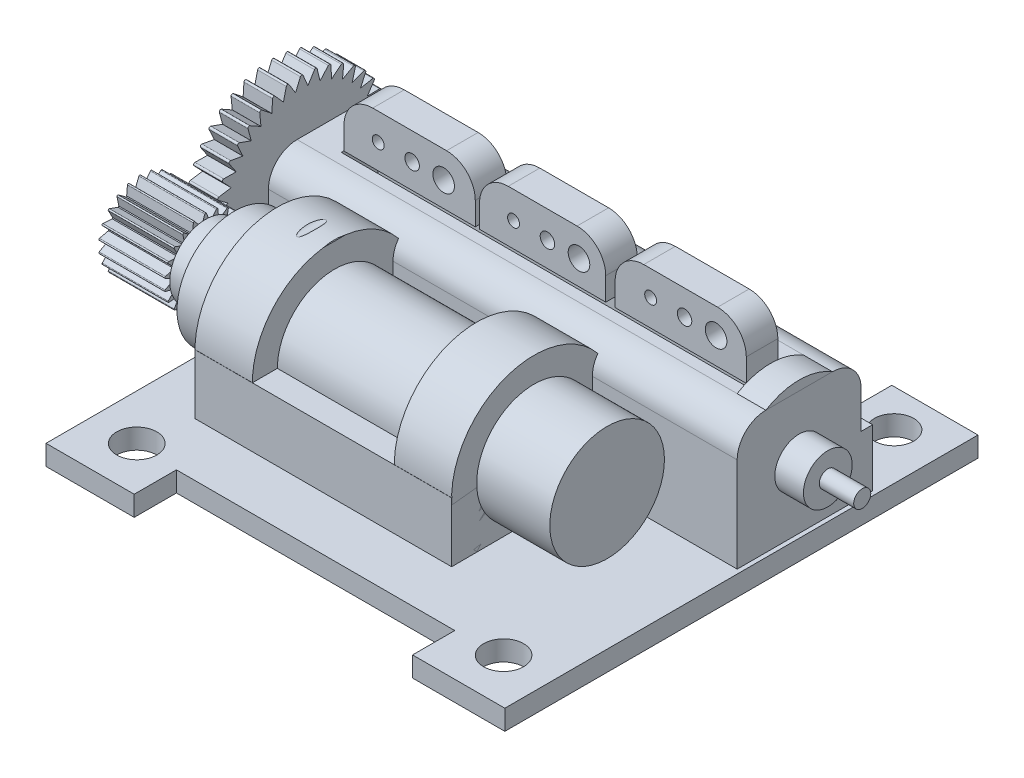
from build123d import *

# Parameters (mm, degrees)
SKETCH1_R            = 0.7
SKETCH1_R_2          = 0.698053641
SKETCH1_R_3          = 0.70259798
SKETCH1_R_4          = 0.686303637
BOSS_EXTRUDE1_DEPTH  = 0.7
SKETCH2_W            = 16.3459471
SKETCH2_H            = 4.323117534
BOSS_EXTRUDE2_DEPTH  = 4.3
SKETCH3_R            = 1.999180089
BOSS_EXTRUDE3_DEPTH  = 13
SKETCH5_R            = 1.25
BOSS_EXTRUDE4_DEPTH  = 1
BOSS_EXTRUDE5_DEPTH  = 2.3
SKETCH7_R            = 1.001282639
BOSS_EXTRUDE6_DEPTH  = 1
BOSS_EXTRUDE7_DEPTH  = 1
SKETCH9_W            = 14.057541038
SKETCH9_H            = 1.275060412
CUT_EXTRUDE1_DEPTH   = 3
SKETCH10_W           = 4.574870121
SKETCH10_H           = 1.1
BOSS_EXTRUDE8_DEPTH  = 1.8
SKETCH11_W           = 1.783665416
SKETCH11_H           = 3.090011918
BOSS_EXTRUDE9_DEPTH  = 1.7
SKETCH12_W           = 4.198120069
SKETCH12_H           = 4.229924008
SKETCH12_W_2         = 2.890350011
SKETCH12_H_2         = 3.141275145
SKETCH12_W_3         = 2.798110633
SKETCH12_H_3         = 1.557438937
SKETCH12_W_4         = 3.160997563
SKETCH12_H_4         = 1.003096265
BOSS_EXTRUDE10_DEPTH = 1
SKETCH13_R           = 0.85
BOSS_EXTRUDE11_DEPTH = 1
SKETCH14_R           = 0.297718491
BOSS_EXTRUDE12_DEPTH = 1.2
SKETCH16_R           = 1.999180089
BOSS_EXTRUDE13_DEPTH = 2
SKETCH17_R           = 1.999180089
BOSS_EXTRUDE17_DEPTH = 2
FILLET1_R            = 1
SKETCH20_R           = 0.20760026
SKETCH20_R_2         = 0.252645321
SKETCH20_R_3         = 0.376796042
CUT_EXTRUDE2_DEPTH   = 2
SKETCH23_W           = 4.574870122
SKETCH23_H           = 1.1
BOSS_EXTRUDE18_DEPTH = 1.8
FILLET2_R            = 1
FILLET3_R            = 1
SKETCH26_W           = 16.3459471
SKETCH26_H           = 2
BOSS_EXTRUDE19_DEPTH = 0.4
BOSS_EXTRUDE20_DEPTH = 1
BOSS_EXTRUDE22_DEPTH = 8.95
SKETCH29_R           = 0.402348732
BOSS_EXTRUDE23_DEPTH = 0.1
SKETCH30_R           = 0.399250569
BOSS_EXTRUDE24_DEPTH = 0.1
SKETCH31_W           = 4.4
SKETCH31_H           = 1.1
BOSS_EXTRUDE26_DEPTH = 1.8
FILLET4_R            = 1
SKETCH32_R           = 0.20760026
SKETCH32_R_2         = 0.252645321
SKETCH32_R_3         = 0.376796042
CUT_EXTRUDE4_DEPTH   = 1.1
SKETCH24_R           = 0.20760026
SKETCH24_R_2         = 0.252645321
SKETCH24_R_3         = 0.376796042
CUT_EXTRUDE5_DEPTH   = 10


with BuildPart() as part:
    # Sketch1 → Boss-Extrude1 (new body)
    with BuildSketch(Plane(origin=(0, 0, 0), x_dir=(1, 0, 0), z_dir=(0, 1, 0))):
        Polygon((-145.69654156, -70.199327588), (-145.69654156, -68.726571204), (-135.989831662, -68.726571204), (-135.989831662, -70.199327588), (-132.772327238, -70.199327588), (-132.772327238, -53.699327588), (-135.777081856, -53.699327588), (-135.777081856, -55.004208719), (-145.69654156, -55.004208719), (-145.69654156, -53.699327588), (-148.772327238, -53.699327588), (-148.772327238, -70.199327588), align=None)
        with Locations(Location((-147.185790201, -68.620196301, 0), (0, 0, 270))):
            Circle(SKETCH1_R, mode=Mode.SUBTRACT)
        with Locations(Location((-134.394208117, -68.620196301, 0), (0, 0, 270))):
            Circle(SKETCH1_R_2, mode=Mode.SUBTRACT)
        with Locations(Location((-147.185790201, -55.004208719, 0), (0, 0, 270))):
            Circle(SKETCH1_R_3, mode=Mode.SUBTRACT)
        with Locations(Location((-134.394208117, -55.004208719, 0), (0, 0, 270))):
            Circle(SKETCH1_R_4, mode=Mode.SUBTRACT)
    extrude(amount=BOSS_EXTRUDE1_DEPTH)



with BuildPart() as body_2:
    # Sketch2 → Boss-Extrude2 (new body)
    with BuildSketch(Plane(origin=(0, 0.7, 0), x_dir=(1, 0, 0), z_dir=(0, 1, 0))):
        with Locations((-141.093486541, -59.787768821)):
            Rectangle(SKETCH2_W, SKETCH2_H)
    extrude(amount=BOSS_EXTRUDE2_DEPTH)

    # Sketch7 → Boss-Extrude6 (add)
    with BuildSketch(Plane.ZY.offset(149.266460091)):
        with Locations(Location((59.787768821, 2.85, 0), (0, 0, 180))):
            Circle(SKETCH7_R)
    extrude(amount=BOSS_EXTRUDE6_DEPTH)



with BuildPart() as body_3:
    # Sketch3 → Boss-Extrude3 (new body)
    with BuildSketch(Plane(origin=(-135.420512991, 0, 0), x_dir=(0, 0, -1), z_dir=(1, 0, 0))):
        with Locations((-63.984477725, 2.780242766)):
            Circle(SKETCH3_R)
    extrude(amount=-BOSS_EXTRUDE3_DEPTH)

    # Sketch5 → Boss-Extrude4 (add)
    with BuildSketch(Plane.ZY.offset(148.420512991)):
        with Locations(Location((63.984477725, 2.780242766, 0), (0, 0, 180))):
            Circle(SKETCH5_R)
    extrude(amount=BOSS_EXTRUDE4_DEPTH)

    # Sketch6 → Boss-Extrude5 (add)
    with BuildSketch(Plane.ZY.offset(149.420512991)):
        with BuildLine():
            Line((63.956467471, 4.202668462), (63.840425796, 3.900130487))
            Line((63.840425796, 3.900130487), (63.807185708, 3.895351284))
            Line((63.807185708, 3.895351284), (63.610609739, 4.152941627))
            ThreePointArc((63.610609739, 4.152941627), (63.578308951, 4.163526576), (63.556858455, 4.137158826))
            Line((63.556858455, 4.137158826), (63.53075208, 3.814183047))
            Line((63.53075208, 3.814183047), (63.500204907, 3.80023262))
            Line((63.500204907, 3.80023262), (63.23902006, 3.992006895))
            ThreePointArc((63.23902006, 3.992006895), (63.205045556, 3.993062895), (63.191892609, 3.961719921))
            Line((63.191892609, 3.961719921), (63.257836518, 3.644471915))
            Line((63.257836518, 3.644471915), (63.232457009, 3.622480445))
            Line((63.232457009, 3.622480445), (62.927822927, 3.732902239))
            ThreePointArc((62.927822927, 3.732902239), (62.89492712, 3.72434374), (62.891137295, 3.690564763))
            Line((62.891137295, 3.690564763), (63.043789105, 3.404746077))
            Line((63.043789105, 3.404746077), (63.025633357, 3.376495182))
            Line((63.025633357, 3.376495182), (62.702229682, 3.396618779))
            ThreePointArc((62.702229682, 3.396618779), (62.673077594, 3.379139139), (62.678957921, 3.345660731))
            Line((62.678957921, 3.345660731), (62.905950689, 3.114426695))
            Line((62.905950689, 3.114426695), (62.896489573, 3.082205094))
            Line((62.896489573, 3.082205094), (62.580516547, 3.010400199))
            ThreePointArc((62.580516547, 3.010400199), (62.557469907, 2.985415516), (62.572543997, 2.954949898))
            Line((62.572543997, 2.954949898), (62.855488119, 2.797033718))
            Line((62.855488119, 2.797033718), (62.855488119, 2.763451814))
            Line((62.855488119, 2.763451814), (62.572543997, 2.605535634))
            ThreePointArc((62.572543997, 2.605535634), (62.557469907, 2.575070016), (62.580516547, 2.550085333))
            Line((62.580516547, 2.550085333), (62.896489573, 2.478280438))
            Line((62.896489573, 2.478280438), (62.905950689, 2.446058838))
            Line((62.905950689, 2.446058838), (62.678957921, 2.214824801))
            ThreePointArc((62.678957921, 2.214824801), (62.673077594, 2.181346393), (62.702229682, 2.163866754))
            Line((62.702229682, 2.163866754), (63.025633357, 2.18399035))
            Line((63.025633357, 2.18399035), (63.043789105, 2.155739455))
            Line((63.043789105, 2.155739455), (62.891137295, 1.869920769))
            ThreePointArc((62.891137295, 1.869920769), (62.89492712, 1.836141792), (62.927822927, 1.827583293))
            Line((62.927822927, 1.827583293), (63.232457009, 1.938005087))
            Line((63.232457009, 1.938005087), (63.257836518, 1.916013617))
            Line((63.257836518, 1.916013617), (63.191892609, 1.598765611))
            ThreePointArc((63.191892609, 1.598765611), (63.205045556, 1.567422637), (63.23902006, 1.568478638))
            Line((63.23902006, 1.568478638), (63.500204907, 1.760252912))
            Line((63.500204907, 1.760252912), (63.53075208, 1.746302485))
            Line((63.53075208, 1.746302485), (63.556858455, 1.423326706))
            ThreePointArc((63.556858455, 1.423326706), (63.578308951, 1.396958956), (63.610609739, 1.407543905))
            Line((63.610609739, 1.407543905), (63.807185708, 1.665134248))
            Line((63.807185708, 1.665134248), (63.840425796, 1.660355045))
            Line((63.840425796, 1.660355045), (63.956467471, 1.357817071))
            ThreePointArc((63.956467471, 1.357817071), (63.984477725, 1.338560703), (64.01248798, 1.357817071))
            Line((64.01248798, 1.357817071), (64.128529654, 1.660355045))
            Line((64.128529654, 1.660355045), (64.161769742, 1.665134248))
            Line((64.161769742, 1.665134248), (64.358345711, 1.407543905))
            ThreePointArc((64.358345711, 1.407543905), (64.390646499, 1.396958956), (64.412096996, 1.423326706))
            Line((64.412096996, 1.423326706), (64.43820337, 1.746302485))
            Line((64.43820337, 1.746302485), (64.468750544, 1.760252912))
            Line((64.468750544, 1.760252912), (64.72993539, 1.568478638))
            ThreePointArc((64.72993539, 1.568478638), (64.763909894, 1.567422637), (64.777062842, 1.598765611))
            Line((64.777062842, 1.598765611), (64.711118932, 1.916013617))
            Line((64.711118932, 1.916013617), (64.736498442, 1.938005087))
            Line((64.736498442, 1.938005087), (65.041132523, 1.827583293))
            ThreePointArc((65.041132523, 1.827583293), (65.074028331, 1.836141792), (65.077818155, 1.869920769))
            Line((65.077818155, 1.869920769), (64.925166346, 2.155739455))
            Line((64.925166346, 2.155739455), (64.943322093, 2.18399035))
            Line((64.943322093, 2.18399035), (65.266725769, 2.163866754))
            ThreePointArc((65.266725769, 2.163866754), (65.295877857, 2.181346393), (65.289997529, 2.214824801))
            Line((65.289997529, 2.214824801), (65.063004761, 2.446058838))
            Line((65.063004761, 2.446058838), (65.072465877, 2.478280438))
            Line((65.072465877, 2.478280438), (65.388438903, 2.550085333))
            ThreePointArc((65.388438903, 2.550085333), (65.411485544, 2.575070016), (65.396411453, 2.605535634))
            Line((65.396411453, 2.605535634), (65.113467331, 2.763451814))
            Line((65.113467331, 2.763451814), (65.113467331, 2.797033718))
            Line((65.113467331, 2.797033718), (65.396411453, 2.954949898))
            ThreePointArc((65.396411453, 2.954949898), (65.411485544, 2.985415516), (65.388438903, 3.010400199))
            Line((65.388438903, 3.010400199), (65.072465877, 3.082205094))
            Line((65.072465877, 3.082205094), (65.063004761, 3.114426695))
            Line((65.063004761, 3.114426695), (65.289997529, 3.345660731))
            ThreePointArc((65.289997529, 3.345660731), (65.295877857, 3.379139139), (65.266725769, 3.396618779))
            Line((65.266725769, 3.396618779), (64.943322093, 3.376495182))
            Line((64.943322093, 3.376495182), (64.925166346, 3.404746077))
            Line((64.925166346, 3.404746077), (65.077818155, 3.690564763))
            ThreePointArc((65.077818155, 3.690564763), (65.074028331, 3.72434374), (65.041132523, 3.732902239))
            Line((65.041132523, 3.732902239), (64.736498442, 3.622480445))
            Line((64.736498442, 3.622480445), (64.711118932, 3.644471915))
            Line((64.711118932, 3.644471915), (64.777062842, 3.961719921))
            ThreePointArc((64.777062842, 3.961719921), (64.763909894, 3.993062895), (64.72993539, 3.992006895))
            Line((64.72993539, 3.992006895), (64.468750544, 3.80023262))
            Line((64.468750544, 3.80023262), (64.43820337, 3.814183047))
            Line((64.43820337, 3.814183047), (64.412096996, 4.137158826))
            ThreePointArc((64.412096996, 4.137158826), (64.390646499, 4.163526576), (64.358345711, 4.152941627))
            Line((64.358345711, 4.152941627), (64.161769742, 3.895351284))
            Line((64.161769742, 3.895351284), (64.128529654, 3.900130487))
            Line((64.128529654, 3.900130487), (64.01248798, 4.202668462))
            ThreePointArc((64.01248798, 4.202668462), (63.984477725, 4.221924829), (63.956467471, 4.202668462))
        make_face()
    extrude(amount=BOSS_EXTRUDE5_DEPTH)


with BuildPart() as body_2_1:
    add(body_2.part)

    add(body_3.part)  # Boss-Extrude7 merges body 3
    # Sketch8 → Boss-Extrude7 (add)
    with BuildSketch(Plane.ZY.offset(150.266460091)):
        with BuildLine():
            Line((59.741673327, 5.84030612), (59.573620283, 5.440388715))
            Line((59.573620283, 5.440388715), (59.341047417, 5.807139882))
            ThreePointArc((59.341047417, 5.807139882), (59.290539109, 5.829764843), (59.250113794, 5.791965744))
            Line((59.250113794, 5.791965744), (59.149211319, 5.36962895))
            Line((59.149211319, 5.36962895), (58.860410883, 5.693310993))
            ThreePointArc((58.860410883, 5.693310993), (58.806867496, 5.707313984), (58.773215057, 5.663376628))
            Line((58.773215057, 5.663376628), (58.743203111, 5.230191955))
            Line((58.743203111, 5.230191955), (58.405065224, 5.501924408))
            ThreePointArc((58.405065224, 5.501924408), (58.349947283, 5.506923465), (58.32398567, 5.458046347))
            Line((58.32398567, 5.458046347), (58.365682902, 5.025829945))
            Line((58.365682902, 5.025829945), (57.987431083, 5.238200654))
            ThreePointArc((57.987431083, 5.238200654), (57.932242061, 5.234059416), (57.914679439, 5.181575777))
            Line((57.914679439, 5.181575777), (58.026948457, 4.762117382))
            Line((58.026948457, 4.762117382), (57.61890043, 4.909333429))
            ThreePointArc((57.61890043, 4.909333429), (57.56514574, 4.896164857), (57.556461172, 4.841506314))
            Line((57.556461172, 4.841506314), (57.73623957, 4.446247658))
            Line((57.73623957, 4.446247658), (57.309525821, 4.524293371))
            ThreePointArc((57.309525821, 4.524293371), (57.25867175, 4.502456671), (57.25910213, 4.447114166))
            Line((57.25910213, 4.447114166), (57.501486021, 4.086836875))
            Line((57.501486021, 4.086836875), (57.067746189, 4.093583372))
            ThreePointArc((57.067746189, 4.093583372), (57.021179905, 4.06367419), (57.030713491, 4.009157324))
            Line((57.030713491, 4.009157324), (57.329091275, 3.693688822))
            Line((57.329091275, 3.693688822), (56.900156652, 3.628952076))
            ThreePointArc((56.900156652, 3.628952076), (56.859148361, 3.591786258), (56.877525103, 3.539582107))
            Line((56.877525103, 3.539582107), (57.223757811, 3.277527554))
            Line((57.223757811, 3.277527554), (56.811328616, 3.143073414))
            ThreePointArc((56.811328616, 3.143073414), (56.776996917, 3.099664746), (56.803715545, 3.051197305))
            Line((56.803715545, 3.051197305), (57.188358852, 2.849704864))
            Line((57.188358852, 2.849704864), (56.803685078, 2.649200889))
            ThreePointArc((56.803685078, 2.649200889), (56.77696645, 2.600733447), (56.811298149, 2.55732478))
            Line((56.811298149, 2.55732478), (57.223859989, 2.421890642))
            Line((57.223859989, 2.421890642), (56.877434533, 2.160806057))
            ThreePointArc((56.877434533, 2.160806057), (56.859057791, 2.108601907), (56.900066083, 2.071436089))
            Line((56.900066083, 2.071436089), (57.329292843, 2.005754543))
            Line((57.329292843, 2.005754543), (57.030565289, 1.691211056))
            ThreePointArc((57.030565289, 1.691211056), (57.021031703, 1.636694189), (57.067597988, 1.606785008))
            Line((57.067597988, 1.606785008), (57.501781482, 1.612647675))
            Line((57.501781482, 1.612647675), (57.258900339, 1.253225212))
            ThreePointArc((57.258900339, 1.253225212), (57.258469959, 1.197882707), (57.30932403, 1.176046007))
            Line((57.30932403, 1.176046007), (57.736620864, 1.253292969))
            Line((57.736620864, 1.253292969), (57.556211296, 0.858795638))
            ThreePointArc((57.556211296, 0.858795638), (57.564895863, 0.804137095), (57.618650553, 0.790968523))
            Line((57.618650553, 0.790968523), (58.027405183, 0.937492685))
            Line((58.027405183, 0.937492685), (57.914388293, 0.518681344))
            ThreePointArc((57.914388293, 0.518681344), (57.931950915, 0.466197705), (57.987139937, 0.462056467))
            Line((57.987139937, 0.462056467), (58.366202602, 0.673861031))
            Line((58.366202602, 0.673861031), (58.323661196, 0.242159762))
            ThreePointArc((58.323661196, 0.242159762), (58.349622809, 0.193282645), (58.40474075, 0.198281702))
            Line((58.40474075, 0.198281702), (58.743771609, 0.469589192))
            Line((58.743771609, 0.469589192), (58.772866107, 0.036773681))
            ThreePointArc((58.772866107, 0.036773681), (58.806518546, -0.007163676), (58.860061933, 0.006839316))
            Line((58.860061933, 0.006839316), (59.149813108, 0.33024917))
            Line((59.149813108, 0.33024917), (59.249749885, -0.091874505))
            ThreePointArc((59.249749885, -0.091874505), (59.290175201, -0.129673604), (59.340683509, -0.107048643))
            Line((59.340683509, -0.107048643), (59.573251343, 0.259641799))
            Line((59.573251343, 0.259641799), (59.741304387, -0.140275606))
            ThreePointArc((59.741304387, -0.140275606), (59.787399881, -0.170905386), (59.833495375, -0.140275606))
            Line((59.833495375, -0.140275606), (60.002536023, 0.259693063))
            Line((60.002536023, 0.259693063), (60.234121284, -0.107109368))
            ThreePointArc((60.234121284, -0.107109368), (60.284629592, -0.129734329), (60.325054908, -0.09193523))
            Line((60.325054908, -0.09193523), (60.425957383, 0.330401564))
            Line((60.425957383, 0.330401564), (60.714757819, 0.006719521))
            ThreePointArc((60.714757819, 0.006719521), (60.768301205, -0.007283471), (60.801953645, 0.036653886))
            Line((60.801953645, 0.036653886), (60.83196559, 0.469838558))
            Line((60.83196559, 0.469838558), (61.170103478, 0.198106106))
            ThreePointArc((61.170103478, 0.198106106), (61.225221419, 0.193107048), (61.251183032, 0.241984166))
            Line((61.251183032, 0.241984166), (61.2094858, 0.674200568))
            Line((61.2094858, 0.674200568), (61.587737619, 0.461829859))
            ThreePointArc((61.587737619, 0.461829859), (61.642926641, 0.465971098), (61.660489262, 0.518454736))
            Line((61.660489262, 0.518454736), (61.548220245, 0.937913131))
            Line((61.548220245, 0.937913131), (61.956268272, 0.790697085))
            ThreePointArc((61.956268272, 0.790697085), (62.010022962, 0.803865657), (62.018707529, 0.858524199))
            Line((62.018707529, 0.858524199), (61.838929132, 1.253782856))
            Line((61.838929132, 1.253782856), (62.265642881, 1.175737142))
            ThreePointArc((62.265642881, 1.175737142), (62.316496951, 1.197573843), (62.316066572, 1.252916347))
            Line((62.316066572, 1.252916347), (62.073682681, 1.613193639))
            Line((62.073682681, 1.613193639), (62.507422512, 1.606447142))
            ThreePointArc((62.507422512, 1.606447142), (62.553988797, 1.636356323), (62.544455211, 1.69087319))
            Line((62.544455211, 1.69087319), (62.246077427, 2.006341692))
            Line((62.246077427, 2.006341692), (62.675012049, 2.071078438))
            ThreePointArc((62.675012049, 2.071078438), (62.716020341, 2.108244256), (62.697643599, 2.160448406))
            Line((62.697643599, 2.160448406), (62.35141089, 2.42250296))
            Line((62.35141089, 2.42250296), (62.763840086, 2.5569571))
            ThreePointArc((62.763840086, 2.5569571), (62.798171785, 2.600365767), (62.771453157, 2.648833209))
            Line((62.771453157, 2.648833209), (62.38680985, 2.850325649))
            Line((62.38680985, 2.850325649), (62.771483624, 3.050829624))
            ThreePointArc((62.771483624, 3.050829624), (62.798202252, 3.099297066), (62.763870552, 3.142705734))
            Line((62.763870552, 3.142705734), (62.351308713, 3.278139872))
            Line((62.351308713, 3.278139872), (62.697734168, 3.539224456))
            ThreePointArc((62.697734168, 3.539224456), (62.716110911, 3.591428607), (62.675102619, 3.628594425))
            Line((62.675102619, 3.628594425), (62.245875858, 3.694275971))
            Line((62.245875858, 3.694275971), (62.544603412, 4.008819458))
            ThreePointArc((62.544603412, 4.008819458), (62.554136999, 4.063336325), (62.507570714, 4.093245506))
            Line((62.507570714, 4.093245506), (62.07338722, 4.087382839))
            Line((62.07338722, 4.087382839), (62.316268363, 4.446805302))
            ThreePointArc((62.316268363, 4.446805302), (62.316698742, 4.502147806), (62.265844672, 4.523984507))
            Line((62.265844672, 4.523984507), (61.838547838, 4.446737545))
            Line((61.838547838, 4.446737545), (62.018957406, 4.841234876))
            ThreePointArc((62.018957406, 4.841234876), (62.010272839, 4.895893419), (61.956518148, 4.90906199))
            Line((61.956518148, 4.90906199), (61.547763518, 4.762537829))
            Line((61.547763518, 4.762537829), (61.660780408, 5.181349169))
            ThreePointArc((61.660780408, 5.181349169), (61.643217787, 5.233832808), (61.588028765, 5.237974046))
            Line((61.588028765, 5.237974046), (61.2089661, 5.026169482))
            Line((61.2089661, 5.026169482), (61.251507505, 5.457870751))
            ThreePointArc((61.251507505, 5.457870751), (61.225545892, 5.506747869), (61.170427951, 5.501748812))
            Line((61.170427951, 5.501748812), (60.831397092, 5.230441322))
            Line((60.831397092, 5.230441322), (60.802302595, 5.663256833))
            ThreePointArc((60.802302595, 5.663256833), (60.768650155, 5.70719419), (60.715106769, 5.693191198))
            Line((60.715106769, 5.693191198), (60.425355594, 5.369781343))
            Line((60.425355594, 5.369781343), (60.325418816, 5.791905019))
            ThreePointArc((60.325418816, 5.791905019), (60.284993501, 5.829704117), (60.234485193, 5.807079156))
            Line((60.234485193, 5.807079156), (60.001917359, 5.440388715))
            Line((60.001917359, 5.440388715), (59.833864315, 5.84030612))
            ThreePointArc((59.833864315, 5.84030612), (59.787768821, 5.8709359), (59.741673327, 5.84030612))
        make_face()
    extrude(amount=BOSS_EXTRUDE7_DEPTH)

    # Sketch9 → Cut-Extrude1 (cut)
    with BuildSketch(Plane(origin=(0, 5, 0), x_dir=(1, 0, 0), z_dir=(0, 1, 0))):
        with Locations((-141.080703457, -59.928357985)):
            Rectangle(SKETCH9_W, SKETCH9_H)
    extrude(amount=-CUT_EXTRUDE1_DEPTH, mode=Mode.SUBTRACT)


with BuildPart() as body_3_2:
    # Sketch10 → Boss-Extrude8 (new body)
    with BuildSketch(Plane(origin=(0, 5, 0), x_dir=(1, 0, 0), z_dir=(0, 1, 0))):
        with Locations((-136.36027587, -59.928357985)):
            Rectangle(SKETCH10_W, SKETCH10_H)
    extrude(amount=BOSS_EXTRUDE8_DEPTH)

    # Fillet1
    fillet1_edges = [body_3_2.edges().sort_by_distance(p)[0] for p in [
        (-134.072840809, 6.8, 59.928357985),
        (-138.64771093, 6.8, 59.928357985),
    ]]
    fillet(fillet1_edges, radius=FILLET1_R)

    # Sketch20 → Cut-Extrude2 (cut)
    with BuildSketch(Plane(origin=(0, 0, 59.378357985), x_dir=(-1, 0, 0), z_dir=(0, 0, -1))):
        with Locations((137.408035372, 5.921072022)):
            Circle(SKETCH20_R)
        with Locations((136.226913284, 5.921072022)):
            Circle(SKETCH20_R_2)
        with Locations((135.126488978, 5.921072022)):
            Circle(SKETCH20_R_3)
    extrude(amount=-CUT_EXTRUDE2_DEPTH, mode=Mode.SUBTRACT)


with BuildPart() as part_1:
    add(part.part)

    add(body_2_1.part)  # Boss-Extrude9 merges body 2
    # Sketch11 → Boss-Extrude9 (add)
    with BuildSketch(Plane.XZ):
        with Locations((-136.549689088, 57.433575997)):
            Rectangle(SKETCH11_W, SKETCH11_H)
    extrude(amount=BOSS_EXTRUDE9_DEPTH)

    # Sketch12 → Boss-Extrude10 (add)
    with BuildSketch(Plane.XZ):
        with Locations((-142.76178848, 65.558831483)):
            Rectangle(SKETCH12_W, SKETCH12_H)
        with Locations((-143.415673508, 58.568055157)):
            Rectangle(SKETCH12_W_2, SKETCH12_H_2)
        with Locations((-136.427071776, 63.715522832)):
            Rectangle(SKETCH12_W_3, SKETCH12_H_3)
        with Locations((-141.835174726, 61.511350776)):
            Rectangle(SKETCH12_W_4, SKETCH12_H_4)
    extrude(amount=BOSS_EXTRUDE10_DEPTH)

    # Sketch13 → Boss-Extrude11 (add)
    with BuildSketch(Plane(origin=(-132.920512991, 0, 0), x_dir=(0, 0, -1), z_dir=(1, 0, 0))):
        with Locations(Location((-59.787768821, 2.85, 0), (0, 0, 180))):
            Circle(SKETCH13_R)
    extrude(amount=BOSS_EXTRUDE11_DEPTH)

    # Sketch14 → Boss-Extrude12 (add)
    with BuildSketch(Plane(origin=(-131.920512991, 0, 0), x_dir=(0, 0, -1), z_dir=(1, 0, 0))):
        with Locations((-59.787768821, 2.85)):
            Circle(SKETCH14_R)
    extrude(amount=BOSS_EXTRUDE12_DEPTH)

    # Sketch16 → Boss-Extrude13 (add)
    with BuildSketch(Plane(origin=(-137.970512991, 0, 0), x_dir=(0, 0, -1), z_dir=(1, 0, 0))):
        with BuildLine():
            Line((-61.985297636, 0.718671674), (-65.983657814, 0.718671674))
            ThreePointArc((-65.983657814, 0.718671674), (-63.984477725, 5.651966359), (-61.985297636, 0.718671674))
        make_face()
        with Locations((-63.984477725, 2.780242766)):
            Circle(SKETCH16_R, mode=Mode.SUBTRACT)
    extrude(amount=-BOSS_EXTRUDE13_DEPTH)

    # Fillet3
    # the kernel refuses this fillet: 1 mm, written as the material it takes off along each edge
    with BuildSketch(Plane(origin=(-130.420512991, 5, 61.949327588), x_dir=(0, -1, 0), z_dir=(-1, 0, 0))) as fillet3_piece_1_section:
        with BuildLine():
            CenterArc((FILLET3_R, -FILLET3_R), FILLET3_R, 90, 90)
            Line((0, -FILLET3_R), (0, 0))
            Line((0, 0), (FILLET3_R, 0))
        make_face()
    fillet3_piece_1 = extrude(amount=21.3459471, mode=Mode.PRIVATE)
    fillet3_piece_1 = split(fillet3_piece_1, bisect_by=Plane(origin=(-137.970512991, 4.344148579, 61.917665824), z_dir=(1, 0, 0)), keep=Keep.TOP, mode=Mode.PRIVATE)
    add(fillet3_piece_1, mode=Mode.SUBTRACT)
    with BuildSketch(Plane(origin=(-130.420512991, 5, 61.949327588), x_dir=(0, -1, 0), z_dir=(-1, 0, 0))) as fillet3_piece_2_section:
        with BuildLine():
            CenterArc((FILLET3_R, -FILLET3_R), FILLET3_R, 90, 90)
            Line((0, -FILLET3_R), (0, 0))
            Line((0, 0), (FILLET3_R, 0))
        make_face()
    fillet3_piece_2 = extrude(amount=21.3459471, mode=Mode.PRIVATE)
    fillet3_piece_2 = split(fillet3_piece_2, bisect_by=Plane(origin=(-139.970512991, 4.344148579, 61.917665824), z_dir=(-1, 0, 0)), keep=Keep.TOP, mode=Mode.PRIVATE)
    fillet3_piece_2 = split(fillet3_piece_2, bisect_by=Plane(origin=(-150.266460091, 4.344148579, 61.917665824), z_dir=(1, 0, 0)), keep=Keep.TOP, mode=Mode.PRIVATE)
    add(fillet3_piece_2, mode=Mode.SUBTRACT)
    with BuildSketch(Plane(origin=(-130.420512991, 5, 61.949327588), x_dir=(0, -1, 0), z_dir=(-1, 0, 0))) as fillet3_piece_3_section:
        with BuildLine():
            CenterArc((FILLET3_R, -FILLET3_R), FILLET3_R, 90, 90)
            Line((0, -FILLET3_R), (0, 0))
            Line((0, 0), (FILLET3_R, 0))
        make_face()
    fillet3_piece_3 = extrude(amount=21.3459471, mode=Mode.PRIVATE)
    fillet3_piece_3 = fillet3_piece_3 - Plane(origin=(-138.970512991, 2.780242766, 63.984477725), x_dir=(0, -0.7178863233430004, 0.6961603455792847), z_dir=(1, 0, 0)) * Cylinder(2.871723593, 47, mode=Mode.PRIVATE)
    fillet3_piece_3 = split(fillet3_piece_3, bisect_by=Plane(origin=(-150.266460091, 4.762036782, 61.785903014), z_dir=(1, 0, 0)), keep=Keep.TOP, mode=Mode.PRIVATE)
    add(fillet3_piece_3, mode=Mode.SUBTRACT)
    with BuildSketch(Plane(origin=(-151.766460091, 5, 57.626210054), x_dir=(0, 0, 1), z_dir=(1, 0, 0))) as fillet3_piece_4_section:
        with BuildLine():
            CenterArc((FILLET3_R, FILLET3_R), FILLET3_R, 180, 90)
            Line((0, FILLET3_R), (0, 0))
            Line((0, 0), (FILLET3_R, 0))
        make_face()
    fillet3_piece_4 = extrude(amount=21.3459471, mode=Mode.PRIVATE)
    fillet3_piece_4 = split(fillet3_piece_4, bisect_by=Plane(origin=(-150.266460091, 4.938476956, 58.146215386), z_dir=(1, 0, 0)), keep=Keep.TOP, mode=Mode.PRIVATE)
    add(fillet3_piece_4, mode=Mode.SUBTRACT)

    # Sketch26 → Boss-Extrude19 (add)
    with BuildSketch(Plane(origin=(0, 0, 57.626210054), x_dir=(-1, 0, 0), z_dir=(0, 0, -1))):
        with Locations((141.093486541, 1.7)):
            Rectangle(SKETCH26_W, SKETCH26_H)
    extrude(amount=BOSS_EXTRUDE19_DEPTH)

    # Sketch29 → Boss-Extrude23 (add)
    with BuildSketch(Plane.ZY.offset(151.266460091)):
        with Locations((59.787584351, 2.850015257)):
            Circle(SKETCH29_R)
    extrude(amount=BOSS_EXTRUDE23_DEPTH)

    # Sketch30 → Boss-Extrude24 (add)
    with BuildSketch(Plane.ZY.offset(151.720512991)):
        with Locations(Location((63.984477725, 2.780242766, 0), (0, 0, 180))):
            Circle(SKETCH30_R)
    extrude(amount=BOSS_EXTRUDE24_DEPTH)


with BuildPart() as body_3_3:
    # Sketch17 → Boss-Extrude17 (new body)
    with BuildSketch(Plane(origin=(-144.920512991, 0, 0), x_dir=(0, 0, -1), z_dir=(1, 0, 0))):
        with BuildLine():
            Line((-65.983657814, 0.718671674), (-62.004733694, 0.7))
            ThreePointArc((-62.004733694, 0.7), (-63.971001897, 5.651934741), (-65.983657814, 0.718671674))
        make_face()
        with Locations((-63.984477725, 2.780242766)):
            Circle(SKETCH17_R, mode=Mode.SUBTRACT)
    extrude(amount=-BOSS_EXTRUDE17_DEPTH)


with BuildPart() as body_4:
    # Sketch23 → Boss-Extrude18 (new body)
    with BuildSketch(Plane(origin=(0, 5, 0), x_dir=(1, 0, 0), z_dir=(0, 1, 0))):
        with Locations((-145.812016968, -59.928357985)):
            Rectangle(SKETCH23_W, SKETCH23_H)
    extrude(amount=BOSS_EXTRUDE18_DEPTH)

    # Fillet2
    fillet2_edges = [body_4.edges().sort_by_distance(p)[0] for p in [
        (-148.099452029, 6.8, 59.928357985),
        (-143.524581907, 6.8, 59.928357985),
    ]]
    fillet(fillet2_edges, radius=FILLET2_R)


with BuildPart() as body_5:
    # Sketch27 → Boss-Extrude20 (new body)
    with BuildSketch(Plane(origin=(-132.920512991, 0, 0), x_dir=(0, 0, -1), z_dir=(1, 0, 0))):
        with BuildLine():
            Line((-60.949327588, 5), (-58.626210054, 5))
            ThreePointArc((-58.626210054, 5), (-59.787768821, 5.333199939), (-60.949327588, 5))
        make_face()
    extrude(amount=-BOSS_EXTRUDE20_DEPTH)


with BuildPart() as body_6:
    # Sketch28 → Boss-Extrude22 (new body)
    with BuildSketch(Plane(origin=(-137.970512991, 0, 0), x_dir=(0, 0, -1), z_dir=(1, 0, 0))):
        with BuildLine():
            Line((-66.856201318, 2.780242766), (-66.856201318, 0.7))
            Line((-66.856201318, 0.7), (-63.994195754, 0.709335837))
            ThreePointArc((-63.994195754, 0.709335837), (-65.394136494, 1.355515727), (-65.983657814, 2.780242766))
            Line((-65.983657814, 2.780242766), (-66.856201318, 2.780242766))
        make_face()
    extrude(amount=-BOSS_EXTRUDE22_DEPTH)


with BuildPart() as body_7:
    # Sketch31 → Boss-Extrude26 (new body)
    with BuildSketch(Plane(origin=(0, 5, 0), x_dir=(1, 0, 0), z_dir=(0, 1, 0))):
        with Locations((-141.174396397, -59.928357985)):
            Rectangle(SKETCH31_W, SKETCH31_H)
    extrude(amount=BOSS_EXTRUDE26_DEPTH)

    # Fillet4
    fillet4_edges = [body_7.edges().sort_by_distance(p)[0] for p in [
        (-143.374396397, 6.8, 59.928357985),
        (-138.974396397, 6.8, 59.928357985),
    ]]
    fillet(fillet4_edges, radius=FILLET4_R)

    # Sketch32 → Cut-Extrude4 (cut)
    with BuildSketch(Plane(origin=(0, 0, 59.378357985), x_dir=(-1, 0, 0), z_dir=(0, 0, -1))):
        with Locations((142.189117291, 5.853159545)):
            Circle(SKETCH32_R)
        with Locations((141.007995202, 5.853159545)):
            Circle(SKETCH32_R_2)
        with Locations((139.907570896, 5.853159545)):
            Circle(SKETCH32_R_3)
    extrude(amount=-CUT_EXTRUDE4_DEPTH, mode=Mode.SUBTRACT)


with BuildPart() as cut_extrude5_tool:
    # Sketch24 → Cut-Extrude5 (new body)
    with BuildSketch(Plane(origin=(0, 0, 59.378357985), x_dir=(-1, 0, 0), z_dir=(0, 0, -1))):
        with Locations((146.908035372, 5.86)):
            Circle(SKETCH24_R)
        with Locations((145.726913284, 5.86)):
            Circle(SKETCH24_R_2)
        with Locations((144.626488978, 5.86)):
            Circle(SKETCH24_R_3)
    extrude(amount=-CUT_EXTRUDE5_DEPTH)


with BuildPart() as body_3_3_1:
    add(body_3_3.part)

    # Cut-Extrude5: cut by cut_extrude5_tool
    add(cut_extrude5_tool.part, mode=Mode.SUBTRACT)


with BuildPart() as body_4_1:
    add(body_4.part)

    # Cut-Extrude5: cut by cut_extrude5_tool
    add(cut_extrude5_tool.part, mode=Mode.SUBTRACT)


solid = Compound([body_3_2.part, part_1.part, body_5.part, body_6.part, body_7.part, body_3_3_1.part, body_4_1.part])
